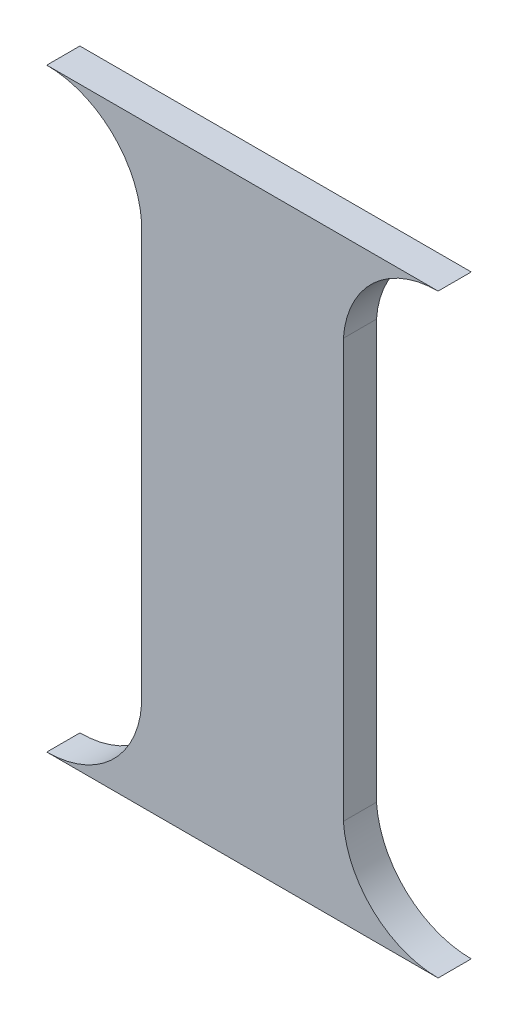
from build123d import *

# Parameters (mm, degrees)
BOSS_EXTRUDE3_DEPTH = 110


with BuildPart() as part:
    # Sketch6 → Boss-Extrude3 (new body)
    with BuildSketch(Plane.XY):
        with BuildLine():
            Line((8389.704370421, 1976), (9689.704370421, 1976))
            ThreePointArc((9689.704370421, 1976), (9474.608247622, 1891.347594916), (9374.901739886, 1682.802673989))
            Line((9374.901739886, 1682.802673989), (9374.901739886, 293.197326011))
            ThreePointArc((9374.901739886, 293.197326011), (9474.608247622, 84.652405084), (9689.704370421, 0))
            Line((9689.704370421, 0), (8389.704370421, 0))
            ThreePointArc((8389.704370421, 0), (8604.800493219, 84.652405084), (8704.507000955, 293.197326011))
            Line((8704.507000955, 293.197326011), (8704.507000955, 1682.802673989))
            ThreePointArc((8704.507000955, 1682.802673989), (8604.800493219, 1891.347594916), (8389.704370421, 1976))
        make_face()
    extrude(amount=BOSS_EXTRUDE3_DEPTH)


solid = part.part
